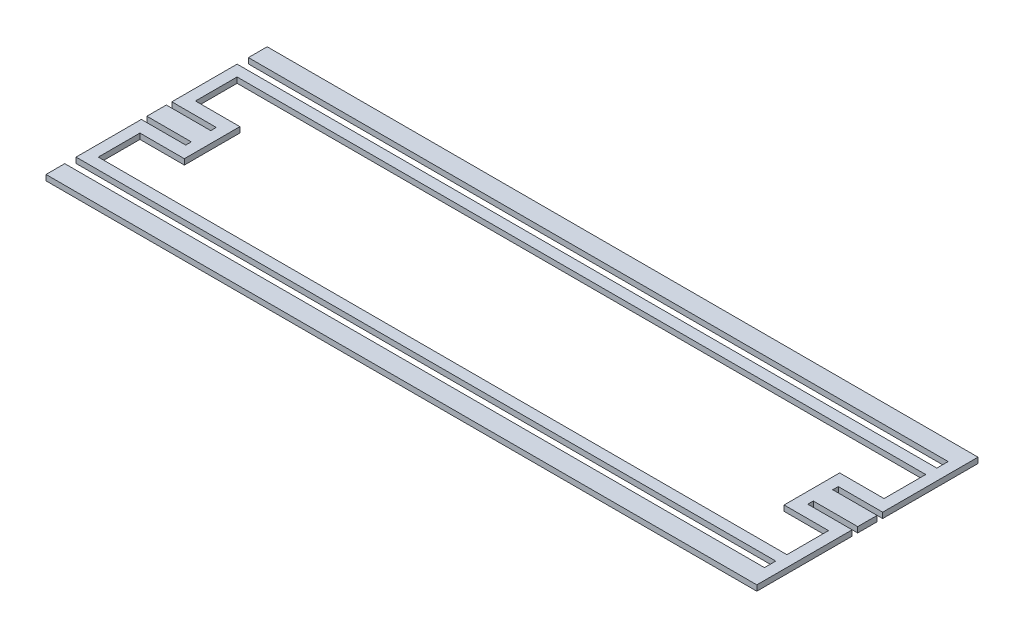
from build123d import *

# Parameters (mm, degrees)
BOSS_EXTRUDE1_DEPTH = 1.5875


with BuildPart() as part:
    # Sketch1 → Boss-Extrude1 (new, symmetric)
    with BuildSketch(Plane(origin=(0, 0, 0), x_dir=(1, 0, 0), z_dir=(0, 1, 0))):
        Polygon((196.85, 46.034325), (-203.2, 46.034325), (-203.2, 8.73125), (-196.85, 8.73125), (-177.8, 8.73125), (-177.8, 5.55625), (-196.85, 5.55625), (-203.2, 5.55625), (-203.2, -5.55625), (-196.85, -5.55625), (-177.8, -5.55625), (-177.8, -8.73125), (-196.85, -8.73125), (-203.2, -8.73125), (-203.2, -46.034325), (196.85, -46.034325), (196.85, -52.511325), (-203.2, -52.511325), (-203.2, -63.22695), (190.5, -63.22695), (203.2, -63.22695), (203.2, -8.73125), (196.85, -8.73125), (177.8, -8.73125), (177.8, -5.55625), (196.85, -5.55625), (203.2, -5.55625), (203.2, 5.55625), (196.85, 5.55625), (177.8, 5.55625), (177.8, 8.73125), (196.85, 8.73125), (203.2, 8.73125), (203.2, 63.22695), (190.5, 63.22695), (-203.2, 63.22695), (-203.2, 52.511325), (196.85, 52.511325), align=None)
        Polygon((196.85, 39.684325), (196.85, 15.875), (171.45, 15.875), (171.45, -15.875), (196.85, -15.875), (196.85, -39.684325), (-196.85, -39.684325), (-196.85, -15.875), (-171.45, -15.875), (-171.45, 15.875), (-196.85, 15.875), (-196.85, 39.684325), align=None, mode=Mode.SUBTRACT)
    extrude(amount=BOSS_EXTRUDE1_DEPTH, both=True)


solid = part.part
